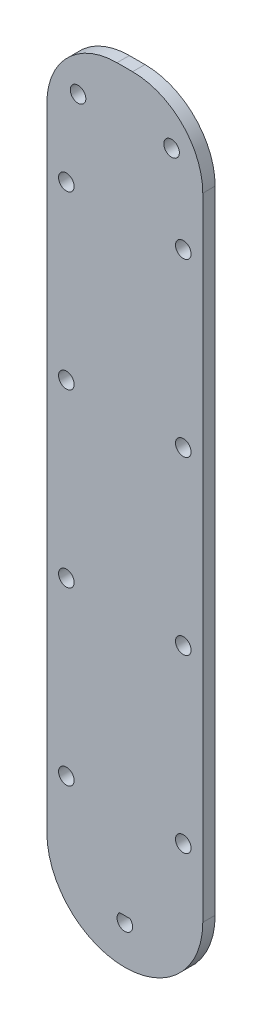
from build123d import *

# Parameters (mm, degrees)
SKETCH2_W           = 40
SKETCH2_H           = 200
BOSS_EXTRUDE1_DEPTH = 3.175
CUT_EXTRUDE1_DEPTH  = 10
FILLET1_R           = 20
FILLET2_R           = 18
SKETCH6_R           = 2
CUT_EXTRUDE4_DEPTH  = 103.029802631
SKETCH7_R           = 2
CUT_EXTRUDE5_DEPTH  = 103.029802631


with BuildPart() as part:
    # Sketch2 → Boss-Extrude1 (new body)
    with BuildSketch(Plane.XY):
        Rectangle(SKETCH2_W, SKETCH2_H)
    extrude(amount=BOSS_EXTRUDE1_DEPTH)

    # Sketch3 → Cut-Extrude1 (cut)
    with BuildSketch(Plane(origin=(0, 0, 0), x_dir=(-1, 0, 0), z_dir=(0, 0, -1))):
        with BuildLine():
            Line((1.325, -88.501876173), (-1.325, -88.501876173))
            ThreePointArc((-1.325, -88.501876173), (0, -92), (1.325, -88.501876173))
        make_face()
    extrude(amount=-CUT_EXTRUDE1_DEPTH, mode=Mode.SUBTRACT)

    # Fillet1
    fillet1_edges = [part.edges().sort_by_distance(p)[0] for p in [
        (20, -100, 1.5875),
        (-20, -100, 1.5875),
    ]]
    fillet(fillet1_edges, radius=FILLET1_R - 0.0001)  # a hair under: the kernel refuses the full size

    # Fillet2
    fillet2_edges = [part.edges().sort_by_distance(p)[0] for p in [
        (-20, 100, 1.5875),
        (20, 100, 1.5875),
    ]]
    fillet(fillet2_edges, radius=FILLET2_R)

    # Sketch6 → Cut-Extrude4 (cut, through all)
    with BuildSketch(Plane.XY.offset(3.175)):
        with Locations((15, 67)):
            Circle(SKETCH6_R)
        with Locations((15, -21)):
            Circle(SKETCH6_R)
        with Locations((15, 23)):
            Circle(SKETCH6_R)
        with Locations((15, -65)):
            Circle(SKETCH6_R)
        with Locations(Location((-15, -65, 0), (0, 0, 180))):
            Circle(SKETCH6_R)
        with Locations(Location((-15, 23, 0), (0, 0, 180))):
            Circle(SKETCH6_R)
        with Locations(Location((-15, -21, 0), (0, 0, 180))):
            Circle(SKETCH6_R)
        with Locations(Location((-15, 67, 0), (0, 0, 180))):
            Circle(SKETCH6_R)
    extrude(amount=-CUT_EXTRUDE4_DEPTH, mode=Mode.SUBTRACT)

    # Sketch7 → Cut-Extrude5 (cut, through all)
    with BuildSketch(Plane.XY.offset(3.175)):
        with Locations((-12, 88)):
            Circle(SKETCH7_R)
        with Locations((12, 88)):
            Circle(SKETCH7_R)
    extrude(amount=-CUT_EXTRUDE5_DEPTH, mode=Mode.SUBTRACT)


solid = part.part
